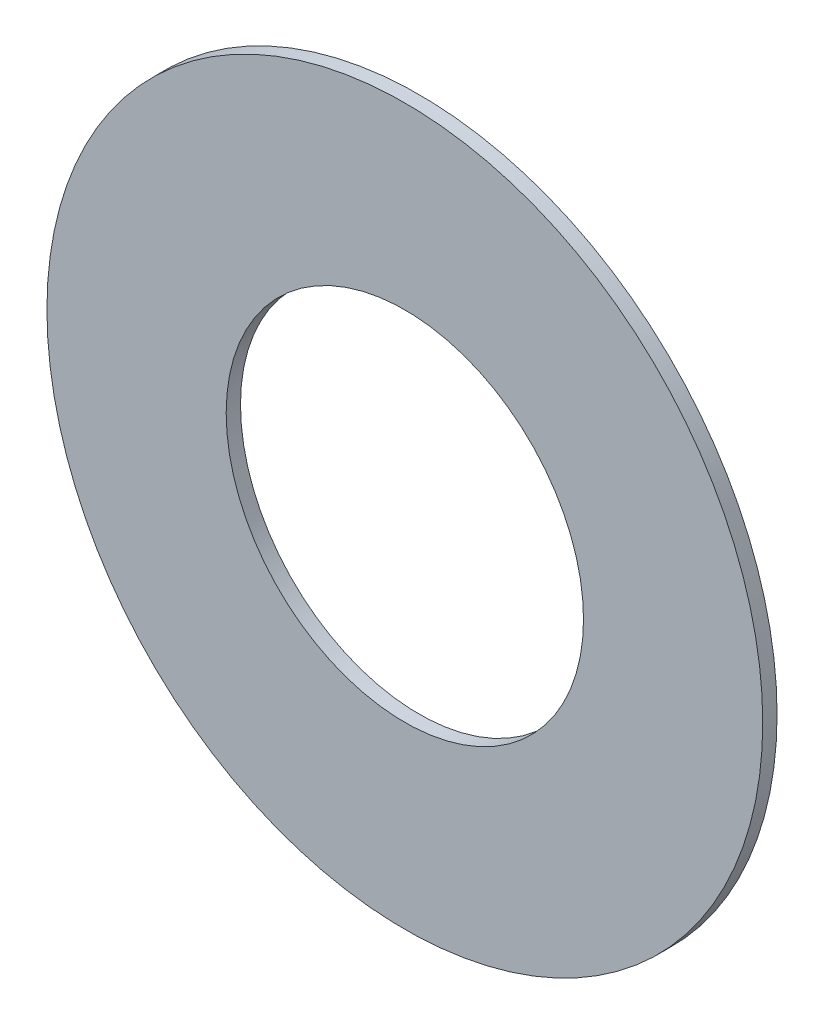
from build123d import *

# Parameters (mm, degrees)
SKETCH1_R           = 79.375
SKETCH1_R_2         = 39.624
BOSS_EXTRUDE1_DEPTH = 3.175


with BuildPart() as part:
    # Sketch1 → Boss-Extrude1 (new body)
    with BuildSketch(Plane.XY):
        Circle(SKETCH1_R)
        Circle(SKETCH1_R_2, mode=Mode.SUBTRACT)
    extrude(amount=BOSS_EXTRUDE1_DEPTH)


solid = part.part
